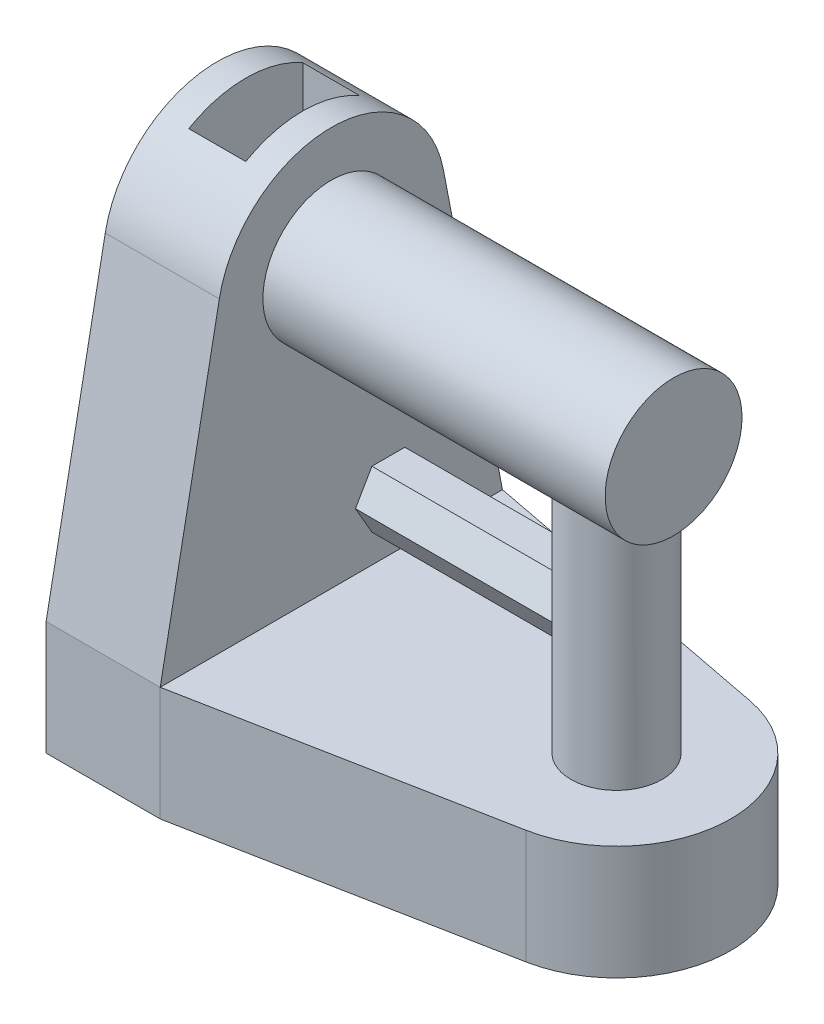
from build123d import *

# Parameters (mm, degrees)
SKETCH1_W                = 10
SKETCH1_H                = 30
BOSS_EXTRUDE1_DEPTH      = 10
BOSS_EXTRUDE2_DEPTH      = 10
SKETCH4_R                = 6
BOSS_EXTRUDE3_DEPTH      = 30
BOSS_EXTRUDE4_REACH      = 57.227
BOSS_EXTRUDE4_END_RADIUS = 6
SKETCH5_R                = 4
BOSS_EXTRUDE5_REACH      = 60.949
BOSS_EXTRUDE5_END_RADIUS = 4
SKETCH7_W                = 9.610963381
SKETCH7_H                = 7.741253353
CUT_EXTRUDE1_DEPTH       = 5
CUT_EXTRUDE2_START       = -2.5
CUT_EXTRUDE2_DEPTH       = 5


# Read off the part's stored shape, not the designer's step: Cut-Extrude2
with BuildPart() as part:
    # Sketch1 → Boss-Extrude1 (new body)
    with BuildSketch(Plane(origin=(0, 0, 0), x_dir=(1, 0, 0), z_dir=(0, 1, 0))):
        Rectangle(SKETCH1_W, SKETCH1_H)
        with BuildLine():
            ThreePointArc((31.891669625, 9.819449375), (40, 0), (31.891669625, -9.819449375))
            Line((31.891669625, -9.819449375), (5, -15))
            Line((5, -15), (5, 15))
            Line((5, 15), (31.891669625, 9.819449375))
        make_face()
    extrude(amount=BOSS_EXTRUDE1_DEPTH)

    # Sketch2 → Boss-Extrude2 (add)
    with BuildSketch(Plane.ZY.offset(5)):
        with BuildLine():
            Line((-15, 10), (-9.819449375, 36.891669625))
            ThreePointArc((-9.819449375, 36.891669625), (0, 45), (9.819449375, 36.891669625))
            Line((9.819449375, 36.891669625), (15, 10))
            Line((15, 10), (-15, 10))
        make_face()
    extrude(amount=-BOSS_EXTRUDE2_DEPTH)

    # Sketch4 → Boss-Extrude3 (add)
    with BuildSketch(Plane(origin=(5, 0, 0), x_dir=(0, 0, -1), z_dir=(1, 0, 0))):
        with Locations((0, 35)):
            Circle(SKETCH4_R)
    extrude(amount=BOSS_EXTRUDE3_DEPTH)

    # Boss-Extrude4: up to this cylinder (the profile starts outside it)
    boss_extrude4_end = Plane(origin=(30, 35, 0), z_dir=(-1, 0, 0)) * Cylinder(BOSS_EXTRUDE4_END_RADIUS, 127.454, mode=Mode.PRIVATE)
    # Sketch5 → Boss-Extrude4 (add, up to the surface)
    with BuildSketch(Plane(origin=(0, 10, 0), x_dir=(1, 0, 0), z_dir=(0, 1, 0)), mode=Mode.PRIVATE) as boss_extrude4_sk1:
        with Locations(Location((30, 0, 0), (0, 0, 90))):
            Circle(SKETCH5_R)
    boss_extrude4_tool1 = extrude(boss_extrude4_sk1.sketch, amount=BOSS_EXTRUDE4_REACH, mode=Mode.PRIVATE) - boss_extrude4_end
    add(boss_extrude4_tool1.solids().sort_by_distance((30, 10, 0))[0])

    # Boss-Extrude5: up to this cylinder (the profile starts outside it)
    boss_extrude5_end = Plane(origin=(30, 20, 0), z_dir=(0, -1, 0)) * Cylinder(BOSS_EXTRUDE5_END_RADIUS, 130.898, mode=Mode.PRIVATE)
    # Sketch6 → Boss-Extrude5 (add, up to the surface)
    with BuildSketch(Plane(origin=(5, 0, 0), x_dir=(0, 0, -1), z_dir=(1, 0, 0)), mode=Mode.PRIVATE) as boss_extrude5_sk1:
        Polygon((-1.443375673, 22.5), (-2.886751346, 20), (-1.443375673, 17.5), (1.443375673, 17.5), (2.886751346, 20), (1.443375673, 22.5), align=None)
    boss_extrude5_tool1 = extrude(boss_extrude5_sk1.sketch, amount=BOSS_EXTRUDE5_REACH, mode=Mode.PRIVATE) - boss_extrude5_end
    add(boss_extrude5_tool1.solids().sort_by_distance((5, 20, 0))[0])

    # Sketch7 → Cut-Extrude1 (cut)
    with BuildSketch(Plane(origin=(5, 0, 0), x_dir=(0, 0, -1), z_dir=(1, 0, 0))):
        with Locations((0.16655936, 19.575208137)):
            Rectangle(SKETCH7_W, SKETCH7_H)
    extrude(amount=CUT_EXTRUDE1_DEPTH, mode=Mode.SUBTRACT)

    # Cut-Extrude2 outline → Cut-Extrude2 (cut)
    with BuildSketch(Plane.YZ.offset(CUT_EXTRUDE2_START)):
        with BuildLine():
            Line((43.660254038, 5), (23.660254038, 5))
            ThreePointArc((23.660254038, 5), (25, 0), (23.660254038, -5))
            Line((23.660254038, -5), (43.660254038, -5))
            ThreePointArc((43.660254038, -5), (45, 0), (43.660254038, 5))
        make_face()
    extrude(amount=CUT_EXTRUDE2_DEPTH, mode=Mode.SUBTRACT)


solid = part.part
